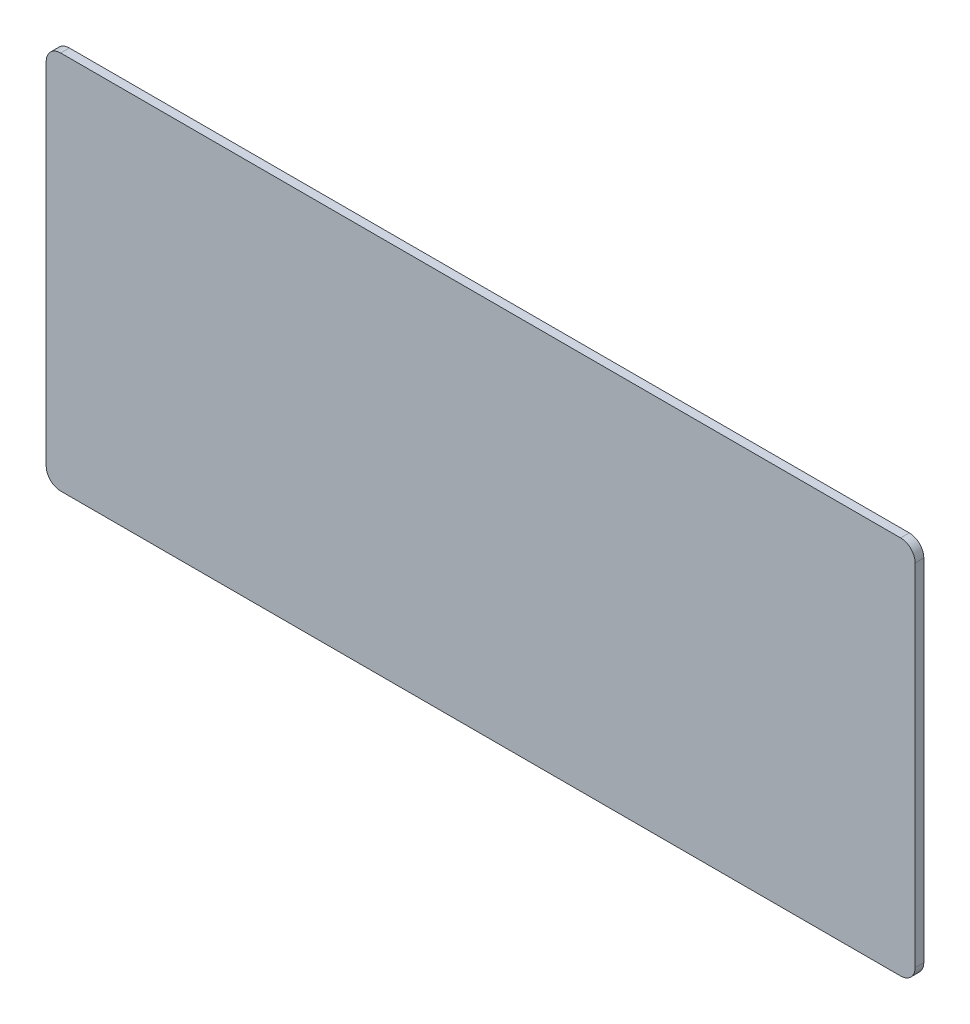
from build123d import *

# Parameters (mm, degrees)
ESBO_O1_W                = 600
ESBO_O1_H                = 250
RESSALTO_EXTRUS_O1_DEPTH = 6
ESBO_O2_W                = 600
ESBO_O2_H                = 6
RESSALTO_EXTRUS_O2_DEPTH = 12
FILETE1_R                = 10


with BuildPart() as part:
    # Esboço1 → Ressalto-extrusão1 (new body)
    with BuildSketch(Plane.XY):
        with Locations((300, -125)):
            Rectangle(ESBO_O1_W, ESBO_O1_H)
    extrude(amount=RESSALTO_EXTRUS_O1_DEPTH)

    # Esboço2 → Ressalto-extrusão2 (add)
    with BuildSketch(Plane.XZ.offset(250)):
        with Locations((300, 3)):
            Rectangle(ESBO_O2_W, ESBO_O2_H)
    extrude(amount=RESSALTO_EXTRUS_O2_DEPTH)

    # Filete1
    filete1_edges = [part.edges().sort_by_distance(p)[0] for p in [
        (0, -262, 3),
        (0, 0, 3),
        (600, -262, 3),
        (600, 0, 3),
    ]]
    fillet(filete1_edges, radius=FILETE1_R)


solid = part.part
